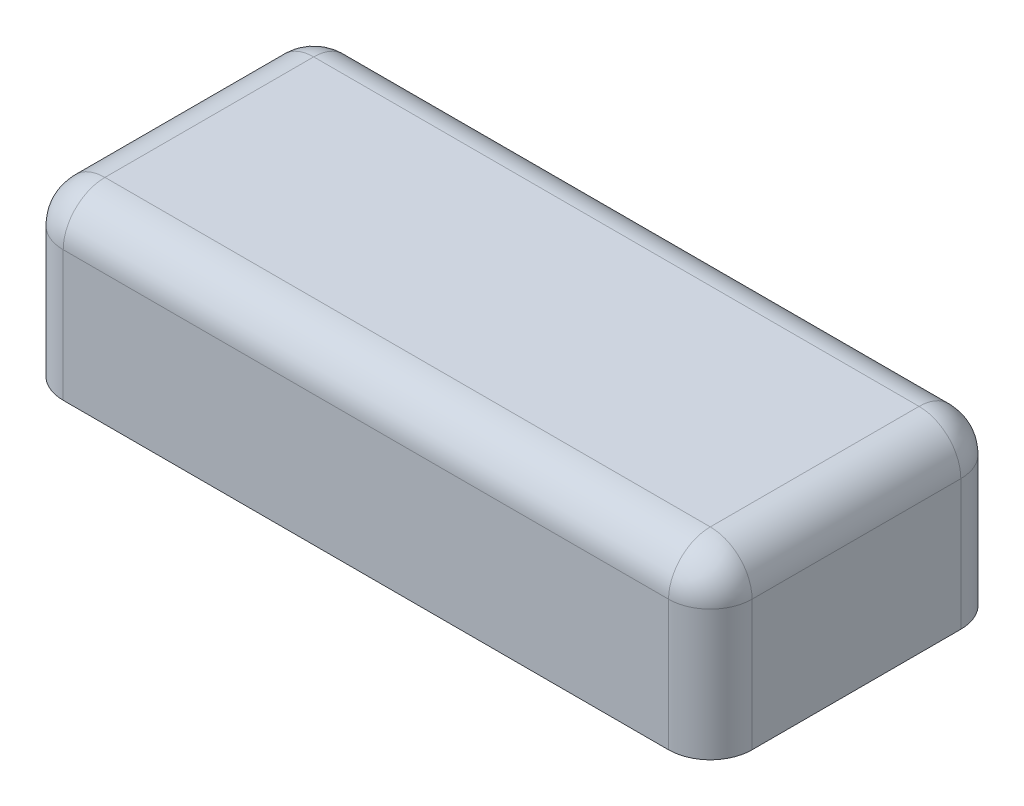
from build123d import *

# Parameters (mm, degrees)
SKETCH1_W           = 66
SKETCH1_H           = 28
SKETCH1_R           = 2
BOSS_EXTRUDE1_DEPTH = 5
SKETCH4_W           = 66
SKETCH4_H           = 28
BOSS_EXTRUDE3_DEPTH = 1
SKETCH5_W           = 66
SKETCH5_H           = 28
SKETCH5_W_2         = 63
SKETCH5_H_2         = 25
BOSS_EXTRUDE4_DEPTH = 9
SKETCH6_W           = 66
SKETCH6_H           = 28
BOSS_EXTRUDE5_DEPTH = 1.5
CUT_EXTRUDE1_REACH  = 41.462
FILLET2_R           = 4


with BuildPart() as part:
    # Sketch1 → Boss-Extrude1 (new body)
    with BuildSketch(Plane(origin=(0, 0, 0), x_dir=(1, 0, 0), z_dir=(0, 1, 0))):
        Rectangle(SKETCH1_W, SKETCH1_H)
        with Locations((-29, 10)):
            Circle(SKETCH1_R, mode=Mode.SUBTRACT)
        with Locations((29, 10)):
            Circle(SKETCH1_R, mode=Mode.SUBTRACT)
        with Locations((29, -10)):
            Circle(SKETCH1_R, mode=Mode.SUBTRACT)
        with Locations((-29, -10)):
            Circle(SKETCH1_R, mode=Mode.SUBTRACT)
    extrude(amount=BOSS_EXTRUDE1_DEPTH)

    # Sketch4 → Boss-Extrude3 (add)
    with BuildSketch(Plane(origin=(0, 5, 0), x_dir=(1, 0, 0), z_dir=(0, 1, 0))):
        Rectangle(SKETCH4_W, SKETCH4_H)
    extrude(amount=BOSS_EXTRUDE3_DEPTH)

    # Sketch5 → Boss-Extrude4 (add)
    with BuildSketch(Plane(origin=(0, 6, 0), x_dir=(1, 0, 0), z_dir=(0, 1, 0))):
        Rectangle(SKETCH5_W, SKETCH5_H)
        Rectangle(SKETCH5_W_2, SKETCH5_H_2, mode=Mode.SUBTRACT)
    extrude(amount=BOSS_EXTRUDE4_DEPTH)

    # Sketch6 → Boss-Extrude5 (add)
    with BuildSketch(Plane(origin=(0, 15, 0), x_dir=(1, 0, 0), z_dir=(0, 1, 0))):
        Rectangle(SKETCH6_W, SKETCH6_H)
    extrude(amount=BOSS_EXTRUDE5_DEPTH)

    # Sketch7 → Cut-Extrude1 (cut, up to next)
    with BuildSketch(Plane.XZ, mode=Mode.PRIVATE) as cut_extrude1_sk1:
        with BuildLine():
            Line((-25.5, 12.5), (25.5, 12.5))
            Line((25.5, 12.5), (25.5, 10))
            ThreePointArc((25.5, 10), (26.525126266, 7.525126266), (29, 6.5))
            Line((29, 6.5), (31.5, 6.5))
            Line((31.5, 6.5), (31.5, 0))
            Line((31.5, 0), (31.5, -6.5))
            Line((31.5, -6.5), (29, -6.5))
            ThreePointArc((29, -6.5), (26.525126266, -7.525126266), (25.5, -10))
            Line((25.5, -10), (25.5, -12.5))
            Line((25.5, -12.5), (-25.5, -12.5))
            Line((-25.5, -12.5), (-25.5, -10))
            ThreePointArc((-25.5, -10), (-26.525126266, -7.525126266), (-29, -6.5))
            Line((-29, -6.5), (-31.5, -6.5))
            Line((-31.5, -6.5), (-31.5, 0))
            Line((-31.5, 0), (-31.5, 6.5))
            Line((-31.5, 6.5), (-29, 6.5))
            ThreePointArc((-29, 6.5), (-26.525126266, 7.525126266), (-25.5, 10))
            Line((-25.5, 10), (-25.5, 12.5))
        make_face()
    cut_extrude1_tool1 = extrude(cut_extrude1_sk1.sketch, amount=-CUT_EXTRUDE1_REACH, mode=Mode.PRIVATE) & part.part
    add(cut_extrude1_tool1.solids().sort_by_distance((0, 0, 0))[0], mode=Mode.SUBTRACT)

    # Fillet2
    fillet2_edges = [part.edges().sort_by_distance(p)[0] for p in [
        (33, 16.5, 0),
        (0, 16.5, 14),
        (-33, 16.5, 0),
        (0, 16.5, -14),
        (-31.5, 15, 0),
        (0, 15, 12.5),
        (31.5, 15, 0),
        (0, 15, -12.5),
        (-33, 8.25, -14),
        (-33, 8.25, 14),
        (33, 8.25, 14),
        (33, 8.25, -14),
    ]]
    fillet(fillet2_edges, radius=FILLET2_R)


solid = part.part
